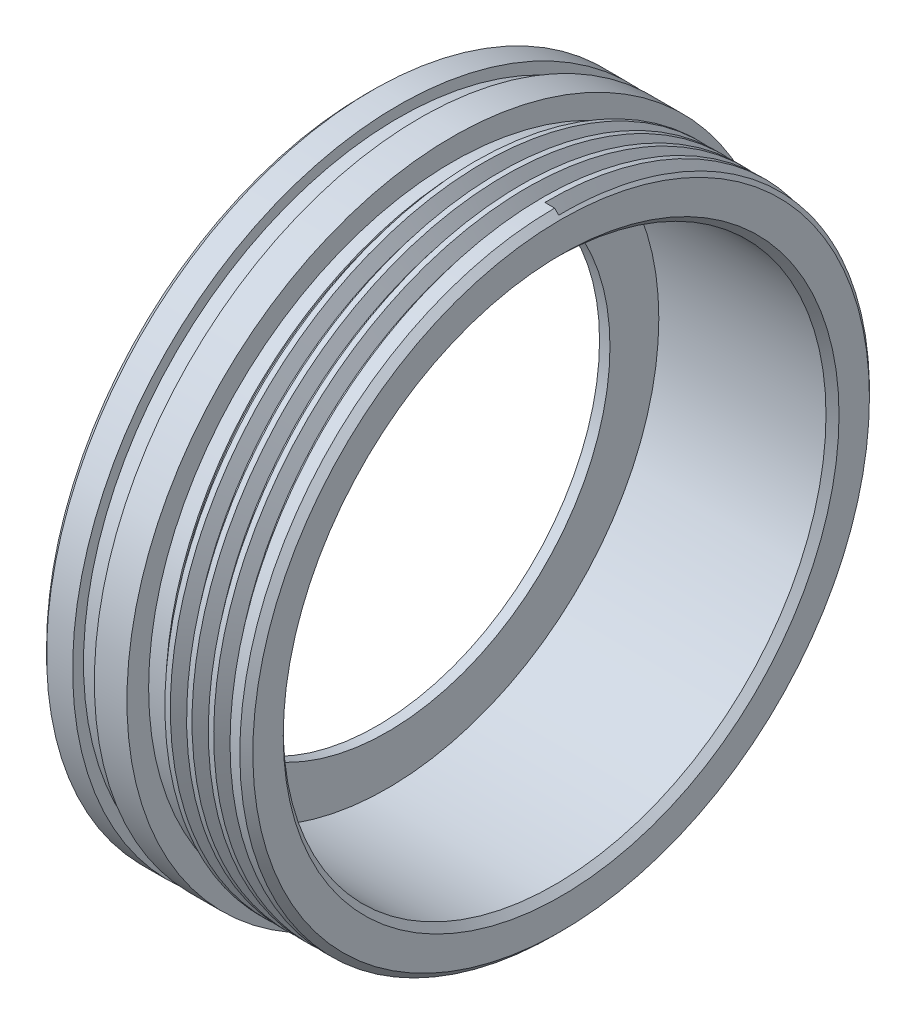
from build123d import *

# Parameters (mm, degrees)
THREAD2_PITCH = 1


with BuildPart() as part:
    # Sketch1 → Revolve1 (revolve)
    with BuildSketch(Plane.XY, mode=Mode.PRIVATE) as revolve1_sk:
        Polygon((0, -11.15), (0, -14.7), (0.3, -15), (1.5, -15), (1.5, -14.5), (2.5, -14.5), (2.5, -15), (4, -15), (4, -14), (5, -14), (5, -14.5), (8.7, -14.5), (9, -14.2), (9, -12.8), (8.7, -12.5), (1, -12.5), (1, -10.25), (0.519615242, -10.25), align=None)
    revolve(revolve1_sk.sketch.rotate(Axis((35.470277062, 0, 0), (-1, 0, 0)), 270), axis=Axis((35.470277062, 0, 0), (-1, 0, 0)))

    # Thread2: the profile of Thread Profile2 profile screwed along a right-hand helix of 4 turns, 8 arcs to a turn; built about Z, then put on its axis
    thread2_z = Axis((0, 0, 0), (0, 0, 1))
    thread2_corners = [(14.5003, 0, 0.750173208), (13.95873412, 0, 0.437500002), (13.95873412, 0, 0.312500002), (14.5003, 0, -0.000173205)]
    with BuildLine(mode=Mode.PRIVATE) as thread2_profile:
        Line(thread2_corners[0], thread2_corners[1])
        Line(thread2_corners[1], thread2_corners[2])
        Line(thread2_corners[2], thread2_corners[3])
        Line(thread2_corners[3], thread2_corners[0])
    thread2_cap = Face(thread2_profile.wire())
    thread2_turn_angles = [0, 22.5, 45, 67.5, 90, 112.5, 135, 157.5, 180, 202.5, 225, 247.5, 270, 292.5, 315, 337.5, 360]
    thread2_turn_weights = [1, 0.9238795325112867, 1, 0.9238795325112867, 1, 0.9238795325112867, 1, 0.9238795325112867, 1, 0.9238795325112867, 1, 0.9238795325112867, 1, 0.9238795325112867, 1, 0.9238795325112867, 1]
    thread2_turn_rails = [Edge.make_bspline([Vector(p[0], p[1], 0).rotate(thread2_z, thread2_turn_angles[k]) / thread2_turn_weights[k] + Vector(0, 0, p[2] + THREAD2_PITCH * thread2_turn_angles[k] / 360) for k in range(17)], [0, 0, 0, 1, 1, 2, 2, 3, 3, 4, 4, 5, 5, 6, 6, 7, 7, 8, 8, 8], 2, thread2_turn_weights) for p in thread2_corners]
    thread2_turn_sides = [Face.make_surface_from_curves(thread2_turn_rails[p[0]], thread2_turn_rails[p[1]]) for p in [(0, 1), (1, 2), (2, 3), (3, 0)]]
    thread2 = Plane(origin=(9, 0, 0), x_dir=(0, 1, 0), z_dir=(-1, 0, 0)) * Solid(Shell([*[p.moved(Location((0, 0, THREAD2_PITCH * i))) for i in range(4) for p in thread2_turn_sides], thread2_cap, thread2_cap.rotate(thread2_z, 1440).moved(Location((0, 0, THREAD2_PITCH * 1440 / 360)))]))
    add(thread2, mode=Mode.SUBTRACT)


solid = part.part
